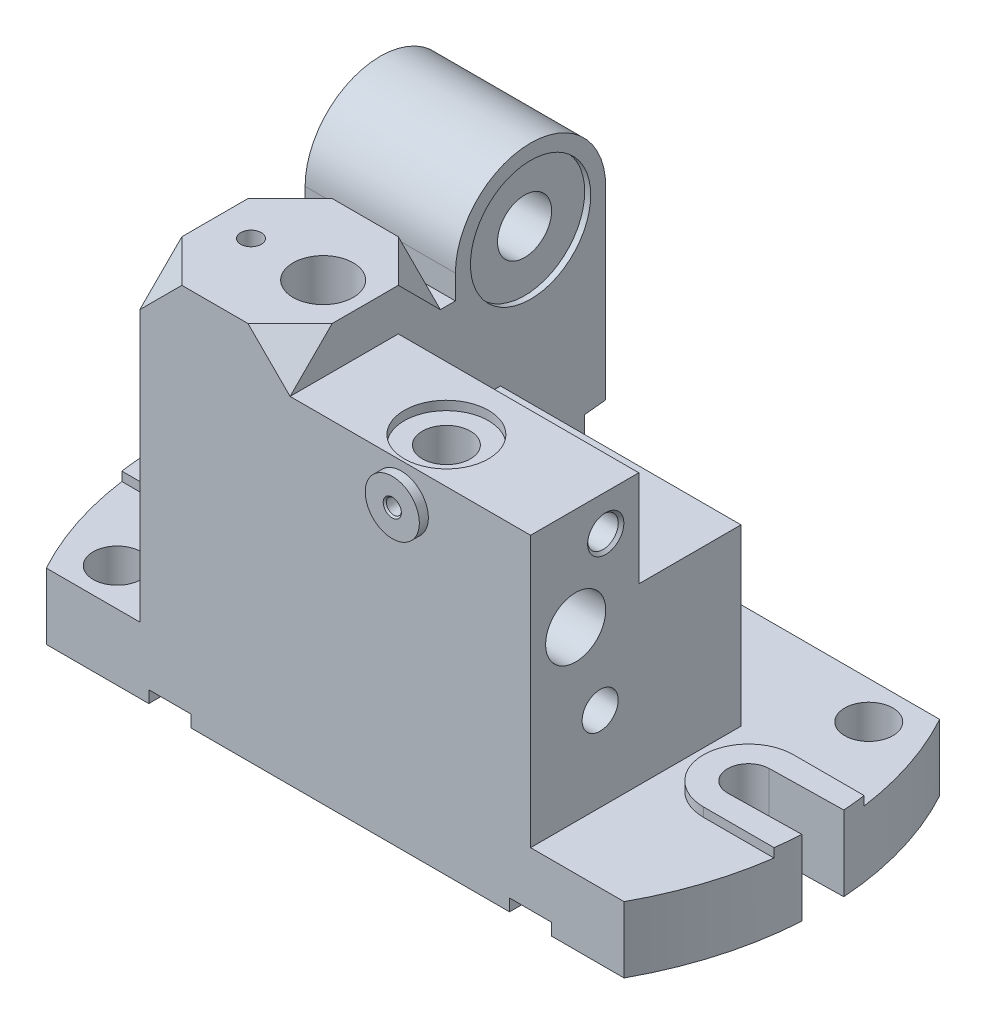
from build123d import *

# Parameters (mm, degrees)
EXTRUDE_1_DEPTH                           = 22
EXTRUDE_2_DEPTH                           = 3
CUT_EXTRUDE_1_DEPTH                       = 124.981853511
F_16_0MM_1_D                              = 16
SKETCH_6_W                                = 80
SKETCH_6_H                                = 36
EXTRUDE_3_DEPTH                           = 112
EXTRUDE_START                             = -22
SKETCH_7_W                                = 80
SKETCH_7_H                                = 34
EXTRUDE_4_DEPTH                           = 80
SKETCH_8_W                                = 50
SKETCH_8_H                                = 105
EXTRUDE_5_DEPTH                           = 112
SKETCH_9_W                                = 50
SKETCH_9_H                                = 50
EXTRUDE_6_DEPTH                           = 14
EXTRUDE_7_DEPTH                           = 50
SKETCH_11_R                               = 20
CUT_EXTRUDE_2_DEPTH                       = 2
SKETCH_12_R                               = 9
CUT_EXTRUDE_3_DEPTH                       = 200.334097768
CUT_EXTRUDE_4_DEPTH                       = 233.730137159
CUT_EXTRUDE_4_DEPTH_BACK                  = 233.730137159
HOLE_WIZARD_M24_1_D                       = 21
HOLE_WIZARD_M24_1_DEPTH                   = 17
HOLE_WIZARD_M24_1_TIP                     = 6.3090365
SKETCH_17_R                               = 10
CUT_EXTRUDE_5_DEPTH                       = 233.730137159
SKETCH_18_W                               = 96
SKETCH_18_H                               = 46
CUT_EXTRUDE_6_DEPTH                       = 60
LOFT_START                                = 86.313865244
LOFT_1_DEPTH                              = 8.686134756
MIRROR_START                              = 86.313865244
MIRROR_2_AT_THE_SECOND_PLANE_COPY_1_DEPTH = 8.686134756
HOLE_START                                = 83
HOLE_WIZARD_1_OUTLINE_R                   = 8
HOLE_WIZARD_1_DEPTH                       = 29
HOLE_START_2                              = 109
HOLE_WIZARD_1_2_OUTLINE_R                 = 14
HOLE_WIZARD_1_2_OUTLINE_R_2               = 8
HOLE_WIZARD_1_2_DEPTH                     = 3
SKETCH_24_R                               = 9
EXTRUDE_8_DEPTH                           = 3
HOLE_WIZARD_M12_1_D                       = 10.2
HOLE_WIZARD_M12_1_DEPTH                   = 30
HOLE_WIZARD_M12_1_CSINK_D                 = 12.05
HOLE_WIZARD_M12_1_CSINK_ANGLE             = 90
HOLE_WIZARD_M12_1_TIP                     = 3.064389157
SKETCH_30_R                               = 12.5
EXTRUDE_9_DEPTH                           = 4
HOLE_WIZARD_M8_1_D                        = 6.8
HOLE_WIZARD_M8_1_DEPTH                    = 20
HOLE_WIZARD_M8_1_CSINK_D                  = 8.05
HOLE_WIZARD_M8_1_CSINK_ANGLE              = 90
HOLE_WIZARD_M8_1_TIP                      = 2.042926105
SKETCH_34_R                               = 3
EXTRUDE_10_DEPTH                          = 3
CUT_EXTRUDE_7_REACH                       = 197.708
SKETCH_35_R                               = 6
SKETCH_39_W                               = 14
SKETCH_39_H                               = 105
CUT_EXTRUDE_9_DEPTH                       = 4
CUT_EXTRUDE_10_REACH                      = 235.425
SKETCH_44_R                               = 6
HOLE_WIZARD_M8_2_D                        = 6.8
HOLE_WIZARD_M8_2_DEPTH                    = 17.957073895
HOLE_WIZARD_M8_2_TIP                      = 2.042926105
SKETCH_47_R                               = 10
CUT_EXTRUDE_11_DEPTH                      = 35
HOLE_WIZARD_M8_3_D                        = 6.8
HOLE_WIZARD_M8_3_DEPTH                    = 17.957073895
HOLE_WIZARD_M8_3_TIP                      = 2.042926105


with BuildPart() as part:
    # 草图1 → 凸台-拉伸1 (new body)
    with BuildSketch(Plane(origin=(0, 0, 0), x_dir=(1, 0, 0), z_dir=(0, 1, 0))):
        with BuildLine():
            Line((96.093704268, 52.5), (-96.093704268, 52.5))
            ThreePointArc((-96.093704268, 52.5), (-109.5, 0), (-96.093704268, -52.5))
            Line((-96.093704268, -52.5), (96.093704268, -52.5))
            Line((96.093704268, -52.5), (96.093704268, 52.5))
        make_face()
        with BuildLine():
            ThreePointArc((109.5, 0), (106.095500888, 27.092336394), (96.093704268, 52.5))
            Line((96.093704268, 52.5), (96.093704268, -52.5))
            ThreePointArc((96.093704268, -52.5), (106.095500888, -27.092336394), (109.5, 0))
        make_face()
    extrude(amount=EXTRUDE_1_DEPTH)

    # 草图2 → 凸台-拉伸2 (add)
    with BuildSketch(Plane(origin=(0, 22, 0), x_dir=(1, 0, 0), z_dir=(0, 1, 0))):
        with BuildLine():
            Line((85, -15), (108.467737139, -15))
            ThreePointArc((108.467737139, -15), (109.5, 0), (108.467737139, 15))
            Line((108.467737139, 15), (85, 15))
            ThreePointArc((85, 15), (70, 0), (85, -15))
        make_face()
    extrude_2 = extrude(amount=EXTRUDE_2_DEPTH)

    # 草图3 → 切除-拉伸1 (cut, through all)
    with BuildSketch(Plane(origin=(0, 25, 0), x_dir=(1, 0, 0), z_dir=(0, 1, 0))):
        with BuildLine():
            Line((84.867167486, 6.998739567), (135.101585821, 7.952163249))
            ThreePointArc((135.101585821, 7.952163249), (142.233157901, 1.086256196), (135.367250848, -6.045315884))
            Line((135.367250848, -6.045315884), (85.132832514, -6.998739567))
            ThreePointArc((85.132832514, -6.998739567), (78.001260433, -0.132832514), (84.867167486, 6.998739567))
        make_face()
    cut_extrude_1 = extrude(amount=-CUT_EXTRUDE_1_DEPTH, mode=Mode.SUBTRACT)

    # 镜向1: 凸台-拉伸2, 切除-拉伸1 across plane
    add(extrude_2.mirror(Plane(origin=(0, 0, 0), x_dir=(0, 0, 1), z_dir=(1, 0, 0))))
    add(cut_extrude_1.mirror(Plane(origin=(0, 0, 0), x_dir=(0, 0, 1), z_dir=(1, 0, 0))), mode=Mode.SUBTRACT)

    # Ø16.0mm 暗销孔1 (through all)
    with Locations(Plane(origin=(0, 22, 0), x_dir=(1, 0, 0), z_dir=(0, 1, 0))):
        with Locations((-85, -40), (85, 40)):
            Hole(F_16_0MM_1_D / 2)

    # 草图6 → 凸台-拉伸3 (add)
    with BuildSketch(Plane(origin=(0, 0, 0), x_dir=(1, 0, 0), z_dir=(0, 1, 0))):
        with Locations((25, -34.5)):
            Rectangle(SKETCH_6_W, SKETCH_6_H)
    extrude(amount=EXTRUDE_3_DEPTH)

    # 草图7 → 凸台-拉伸4 (add)
    with BuildSketch(Plane(origin=(0, 22, 0), x_dir=(1, 0, 0), z_dir=(0, 1, 0)).offset(EXTRUDE_START)):
        with Locations((25, 0.5)):
            Rectangle(SKETCH_7_W, SKETCH_7_H)
    extrude(amount=EXTRUDE_4_DEPTH)

    # 草图8 → 凸台-拉伸5 (add)
    with BuildSketch(Plane(origin=(0, 22, 0), x_dir=(1, 0, 0), z_dir=(0, 1, 0)).offset(EXTRUDE_START)):
        with Locations((-40, 0)):
            Rectangle(SKETCH_8_W, SKETCH_8_H)
    extrude(amount=EXTRUDE_5_DEPTH)

    # 草图9 → 凸台-拉伸6 (add)
    with BuildSketch(Plane(origin=(0, 112, 0), x_dir=(1, 0, 0), z_dir=(0, 1, 0))):
        with Locations((-40, -27.5)):
            Rectangle(SKETCH_9_W, SKETCH_9_H)
    extrude(amount=EXTRUDE_6_DEPTH)

    # 草图10 → 凸台-拉伸7 (add)
    with BuildSketch(Plane(origin=(-15, 0, 0), x_dir=(0, 0, -1), z_dir=(1, 0, 0))):
        with BuildLine():
            Line((52.5, 112), (2.5, 112))
            Line((2.5, 112), (2.5, 120))
            ThreePointArc((2.5, 120), (27.5, 145), (52.5, 120))
            Line((52.5, 120), (52.5, 112))
        make_face()
    extrude(amount=-EXTRUDE_7_DEPTH)

    # 草图11 → 切除-拉伸2 (cut)
    with BuildSketch(Plane(origin=(-15, 0, 0), x_dir=(0, 0, -1), z_dir=(1, 0, 0))):
        with Locations((27.5, 120)):
            Circle(SKETCH_11_R)
    extrude(amount=-CUT_EXTRUDE_2_DEPTH, mode=Mode.SUBTRACT)

    # 草图12 → 切除-拉伸3 (cut, through all)
    with BuildSketch(Plane(origin=(-17, 0, 0), x_dir=(0, 0, -1), z_dir=(1, 0, 0))):
        with Locations((27.5, 120)):
            Circle(SKETCH_12_R)
    extrude(amount=-CUT_EXTRUDE_3_DEPTH, mode=Mode.SUBTRACT)

    # 草图13 → 切除-拉伸4 (cut, two sides: drawn at the far end of the back side and taken through both)
    with BuildSketch(Plane.ZY.offset(65).offset(-CUT_EXTRUDE_4_DEPTH_BACK)):
        Polygon((-357.737844579, 7.295945224), (-52.5, 40), (-45.5, 40.75), (-45.5, 57.75), (-52.5, 58.5), (-357.737844579, 91.204054776), (-971.707540776, 91.204054776), (-971.707540776, 7.295945224), align=None)
    extrude(amount=CUT_EXTRUDE_4_DEPTH + CUT_EXTRUDE_4_DEPTH_BACK, mode=Mode.SUBTRACT)

    # M24 螺纹孔1
    with Locations(Plane.ZY.offset(65)):
        with Locations((37.5, 78)):
            Hole(HOLE_WIZARD_M24_1_D / 2, depth=HOLE_WIZARD_M24_1_DEPTH)
            with Locations((0, 0, -(HOLE_WIZARD_M24_1_DEPTH + HOLE_WIZARD_M24_1_TIP / 2))):  # 118° drill point
                Cone(0, HOLE_WIZARD_M24_1_D / 2, HOLE_WIZARD_M24_1_TIP, mode=Mode.SUBTRACT)

    # 草图17 → 切除-拉伸5 (cut, through all)
    with BuildSketch(Plane.ZY.offset(65)):
        with Locations((37.5, 78)):
            Circle(SKETCH_17_R)
    extrude(amount=-CUT_EXTRUDE_5_DEPTH, mode=Mode.SUBTRACT)

    # 草图18 → 切除-拉伸6 (cut)
    with BuildSketch(Plane.XZ):
        with Locations((5, 17.5)):
            Rectangle(SKETCH_18_W, SKETCH_18_H)
    extrude(amount=-CUT_EXTRUDE_6_DEPTH, mode=Mode.SUBTRACT)

    # 切除-放样1: read off the stored shape, not the designer's step
    # 切除-放样1 outline → 切除-放样1 (cut)
    with BuildSketch(Plane(origin=(0, 0, 0), x_dir=(0.8164965809277258, -0.40824829046386313, -0.40824829046386313), z_dir=(0.5773502691896258, 0.5773502691896258, 0.5773502691896258)).offset(LOFT_START)):
        Polygon((-96.550720695, 51.972348417), (-79.404292495, 42.072853481), (-79.404292495, 61.871843354), align=None)
    loft_1 = extrude(amount=LOFT_1_DEPTH, mode=Mode.SUBTRACT)

    # 镜向2: 切除-放样1 across plane
    add(loft_1.mirror(Plane.ZY.offset(40)), mode=Mode.SUBTRACT)

    # 镜向2 at the second plane: 切除-放样1 across plane
    add(loft_1.mirror(Plane(origin=(0, 0, 27.5), x_dir=(1, 0, 0), z_dir=(0, 0, -1))), mode=Mode.SUBTRACT)

    # 镜向2 at the second plane copy 1 sket → 镜向2 at the second plane copy 1 (cut)
    with BuildSketch(Plane(origin=(-80, 0, 55), x_dir=(-0.816496580927726, -0.40824829046386313, 0.4082482904638627), z_dir=(-0.5773502691896255, 0.5773502691896258, -0.5773502691896262)).offset(MIRROR_START)):
        Polygon((-96.550720695, 51.972348417), (-79.404292495, 42.072853481), (-79.404292495, 61.871843354), align=None)
    extrude(amount=MIRROR_2_AT_THE_SECOND_PLANE_COPY_1_DEPTH, mode=Mode.SUBTRACT)

    # 孔1: read off the stored shape, not the designer's step
    # 孔1 outline → 孔1 (cut)
    with BuildSketch(Plane(origin=(0, 0, 0), x_dir=(1, 0, 0), z_dir=(0, 1, 0)).offset(HOLE_START)):
        with Locations((22, -37.5)):
            Circle(HOLE_WIZARD_1_OUTLINE_R)
    extrude(amount=HOLE_WIZARD_1_DEPTH, mode=Mode.SUBTRACT)

    # Hole Wizard 1 2 outline → Hole Wizard 1 2 (cut)
    with BuildSketch(Plane(origin=(0, 0, 0), x_dir=(1, 0, 0), z_dir=(0, 1, 0)).offset(HOLE_START_2)):
        with Locations((22, -37.5)):
            Circle(HOLE_WIZARD_1_2_OUTLINE_R)
        with Locations((22, -37.5)):
            Circle(HOLE_WIZARD_1_2_OUTLINE_R_2, mode=Mode.SUBTRACT)
    extrude(amount=HOLE_WIZARD_1_2_DEPTH, mode=Mode.SUBTRACT)

    # 草图24 → 凸台-拉伸8 (add)
    with BuildSketch(Plane.XY.offset(52.5)):
        with Locations((22, 100)):
            Circle(SKETCH_24_R)
    extrude(amount=EXTRUDE_8_DEPTH)

    # M6 螺纹孔1: read off the stored shape, not the designer's step
    # M6 螺纹孔1 outline → M6 螺纹孔1 (revolve, cut)
    with BuildSketch(Plane(origin=(22, 100, 0), x_dir=(1, 0, 0), z_dir=(0, -1, 0))):
        Polygon((0, 45.099172166), (2.5, 45.099172166), (2.5, 54.975), (3.025, 55.5), (0, 55.5), align=None)
    revolve(axis=Axis((22, 100, 0), (0, 0, 1)), mode=Mode.SUBTRACT)

    # M12 螺纹孔1
    with Locations(Plane(origin=(65, 0, 0), x_dir=(0, 0, -1), z_dir=(1, 0, 0))):
        with Locations((-27.5, 100)):
            CounterSinkHole(HOLE_WIZARD_M12_1_D / 2, HOLE_WIZARD_M12_1_CSINK_D / 2, depth=HOLE_WIZARD_M12_1_DEPTH, counter_sink_angle=HOLE_WIZARD_M12_1_CSINK_ANGLE)
            with Locations((0, 0, -(HOLE_WIZARD_M12_1_DEPTH + HOLE_WIZARD_M12_1_TIP / 2))):  # 118° drill point
                Cone(0, HOLE_WIZARD_M12_1_D / 2, HOLE_WIZARD_M12_1_TIP, mode=Mode.SUBTRACT)

    # 草图30 → 凸台-拉伸9 (add)
    with BuildSketch(Plane.XZ.offset(-60)):
        with Locations(Location((25, 17.5, 0), (0, 0, 90))):
            Circle(SKETCH_30_R)
    extrude(amount=EXTRUDE_9_DEPTH)

    # M8 螺纹孔1
    with Locations(Plane(origin=(0, 56, 0), x_dir=(-1, 0, 0), z_dir=(0, -1, 0))):
        with Locations((-25, -17.5)):
            CounterSinkHole(HOLE_WIZARD_M8_1_D / 2, HOLE_WIZARD_M8_1_CSINK_D / 2, depth=HOLE_WIZARD_M8_1_DEPTH, counter_sink_angle=HOLE_WIZARD_M8_1_CSINK_ANGLE)
            with Locations((0, 0, -(HOLE_WIZARD_M8_1_DEPTH + HOLE_WIZARD_M8_1_TIP / 2))):  # 118° drill point
                Cone(0, HOLE_WIZARD_M8_1_D / 2, HOLE_WIZARD_M8_1_TIP, mode=Mode.SUBTRACT)

    # 草图34 → 凸台-拉伸10 (add)
    with BuildSketch(Plane(origin=(0, 0, 40.5), x_dir=(-1, 0, 0), z_dir=(0, 0, -1))):
        with Locations(Location((0, 50, 0), (0, 0, 180))):
            Circle(SKETCH_34_R)
    extrude(amount=EXTRUDE_10_DEPTH)

    # 草图35 → 切除-拉伸7 (cut, up to next)
    with BuildSketch(Plane(origin=(0, 0, -17.5), x_dir=(-1, 0, 0), z_dir=(0, 0, -1)), mode=Mode.PRIVATE) as cut_extrude_7_sk1:
        with Locations((0, 50)):
            Circle(SKETCH_35_R)
    cut_extrude_7_tool1 = extrude(cut_extrude_7_sk1.sketch, amount=-CUT_EXTRUDE_7_REACH, mode=Mode.PRIVATE) & part.part
    add(cut_extrude_7_tool1.solids().sort_by_distance((0, 50, -17.5))[0], mode=Mode.SUBTRACT)

    # 草图39 → 切除-拉伸9 (cut)
    with BuildSketch(Plane.XZ):
        with Locations((-55, 0)):
            Rectangle(SKETCH_39_W, SKETCH_39_H)
    cut_extrude_9 = extrude(amount=-CUT_EXTRUDE_9_DEPTH, mode=Mode.SUBTRACT)

    # 草图43 → M5 螺纹孔2 (revolve, cut)
    with BuildSketch(Plane(origin=(-55, 4, 0), x_dir=(0, 0, -1), z_dir=(1, 0, 0))):
        Polygon((0, 0), (0, 15.2618073), (2.1, 14), (2.1, 0.425), (2.525, 0), align=None)
    hole_wizard_m5_2 = revolve(axis=Axis((-55, -2.35, 0), (0, 1, 0)), mode=Mode.SUBTRACT)

    # 镜向5: 切除-拉伸9, M5 螺纹孔2 across plane
    add(cut_extrude_9.mirror(Plane.ZY.offset(-5)), mode=Mode.SUBTRACT)
    add(hole_wizard_m5_2.mirror(Plane.ZY.offset(-5)), mode=Mode.SUBTRACT)

    # 草图44 → 切除-拉伸10 (cut, up to next)
    with BuildSketch(Plane(origin=(65, 0, 0), x_dir=(0, 0, -1), z_dir=(1, 0, 0)), mode=Mode.PRIVATE) as cut_extrude_10_sk1:
        with Locations((-29.359794418, 50)):
            Circle(SKETCH_44_R)
    cut_extrude_10_tool1 = extrude(cut_extrude_10_sk1.sketch, amount=-CUT_EXTRUDE_10_REACH, mode=Mode.PRIVATE) & part.part
    add(cut_extrude_10_tool1.solids().sort_by_distance((65, 50, 29.359794))[0], mode=Mode.SUBTRACT)

    # M8 螺纹孔2
    with Locations(Plane(origin=(0, 126, 0), x_dir=(1, 0, 0), z_dir=(0, 1, 0))):
        with Locations((-53, -27.5)):
            Hole(HOLE_WIZARD_M8_2_D / 2, depth=HOLE_WIZARD_M8_2_DEPTH)
            with Locations((0, 0, -(HOLE_WIZARD_M8_2_DEPTH + HOLE_WIZARD_M8_2_TIP / 2))):  # 118° drill point
                Cone(0, HOLE_WIZARD_M8_2_D / 2, HOLE_WIZARD_M8_2_TIP, mode=Mode.SUBTRACT)

    # 草图47 → 切除-拉伸11 (cut)
    with BuildSketch(Plane(origin=(0, 126, 0), x_dir=(1, 0, 0), z_dir=(0, 1, 0))):
        with Locations(Location((-29, -27.5, 0), (0, 0, 270))):
            Circle(SKETCH_47_R)
    extrude(amount=-CUT_EXTRUDE_11_DEPTH, mode=Mode.SUBTRACT)

    # M8 螺纹孔3
    with Locations(Plane(origin=(0, 0, -45.5), x_dir=(-1, 0, 0), z_dir=(0, 0, -1))):
        with Locations((53, 49.25), (27, 49.25)):
            Hole(HOLE_WIZARD_M8_3_D / 2, depth=HOLE_WIZARD_M8_3_DEPTH)
            with Locations((0, 0, -(HOLE_WIZARD_M8_3_DEPTH + HOLE_WIZARD_M8_3_TIP / 2))):  # 118° drill point
                Cone(0, HOLE_WIZARD_M8_3_D / 2, HOLE_WIZARD_M8_3_TIP, mode=Mode.SUBTRACT)


solid = part.part
